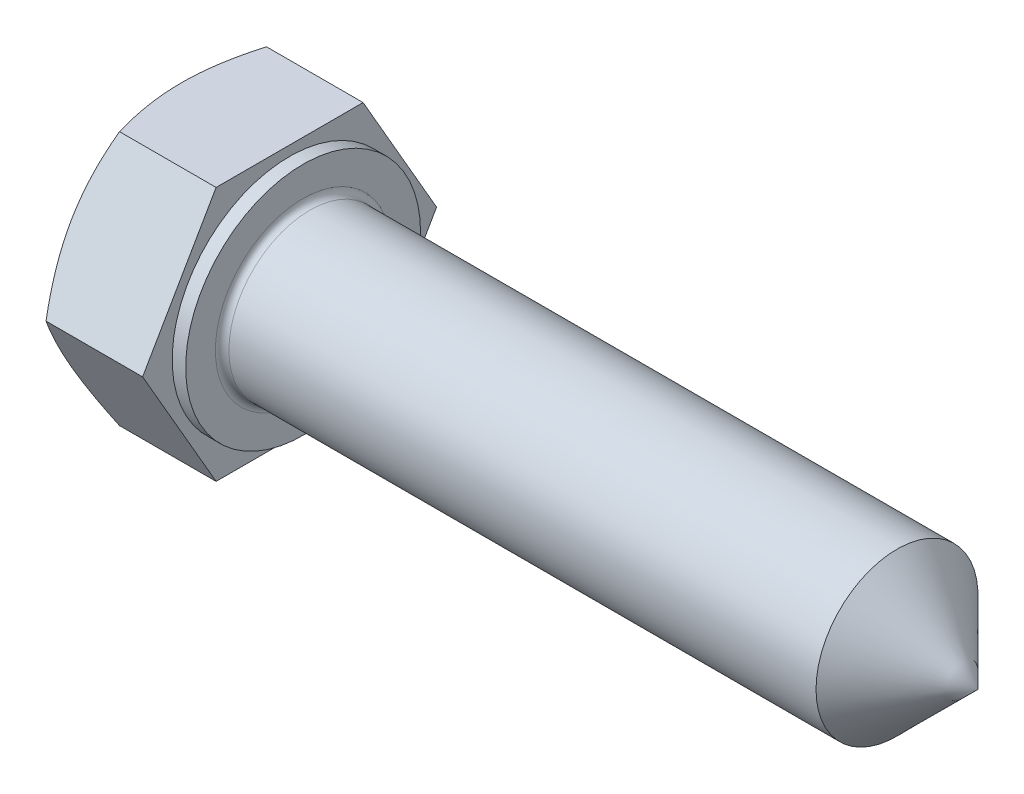
from build123d import *

# Parameters (mm, degrees)
BASEHEAD_DEPTH = 4
SKETCH2_R      = 4.35
NECK_DEPTH     = 0.5
SKETCH1_R      = 3
BASEBODY_DEPTH = 25
FILLET1_R      = 0.25


with BuildPart() as part:
    # Sketch3 → BaseHead (new body)
    with BuildSketch(Plane(origin=(0, 0, 0), x_dir=(0, 0, -1), z_dir=(1, 0, 0))):
        Polygon((-5.445, 0), (-2.7225, -4.715508324), (2.7225, -4.715508324), (5.445, 0), (2.7225, 4.715508324), (-2.7225, 4.715508324), align=None)
    extrude(amount=BASEHEAD_DEPTH)

    # Sketch2 → Neck (add)
    with BuildSketch(Plane(origin=(4, -1.739290844, 0.869299355), x_dir=(0, 0, -1), z_dir=(1, 0, 0))):
        with Locations((0.869299355, 1.739290844)):
            Circle(SKETCH2_R)
    extrude(amount=NECK_DEPTH)

    # Sketch1 → BaseBody (add)
    with BuildSketch(Plane(origin=(4.5, -1.883204373, 0.262725016), x_dir=(0, 0, -1), z_dir=(1, 0, 0))):
        with Locations((0.262725016, 1.883204373)):
            Circle(SKETCH1_R)
    extrude(amount=BASEBODY_DEPTH)

    # Sketch4 → Cut-Revolve1 (revolve, cut)
    with BuildSketch(Plane(origin=(6.906383039, 0, -1.461383039), x_dir=(0, 0, -1), z_dir=(0, 1, 0))):
        Polygon((3.983616961, 6.906383039), (3.983616961, 6.485210824), (3.254125284, 6.906383039), align=None)
    revolve(axis=Axis((7.793963302, 0, 0), (-1, 0, 0)), mode=Mode.SUBTRACT)

    # Sketch6 → Cut-Revolve2 (revolve, cut)
    with BuildSketch(Plane(origin=(-10.579812955, 0, 31.579812955), x_dir=(0, 0, -1), z_dir=(0, 1, 0))):
        Polygon((31.579812955, -43.014603925), (52.579812955, -43.014603925), (52.579812955, -19.079812955), (31.579812955, -40.079812955), align=None)
    revolve(axis=Axis((-9.009671077, 0, 0), (1, 0, 0)), mode=Mode.SUBTRACT)

    # Fillet1
    fillet1_edges = [part.edges().sort_by_distance(p)[0] for p in [
        (4.5, 0, 3),
    ]]
    fillet(fillet1_edges, radius=FILLET1_R)


solid = part.part
